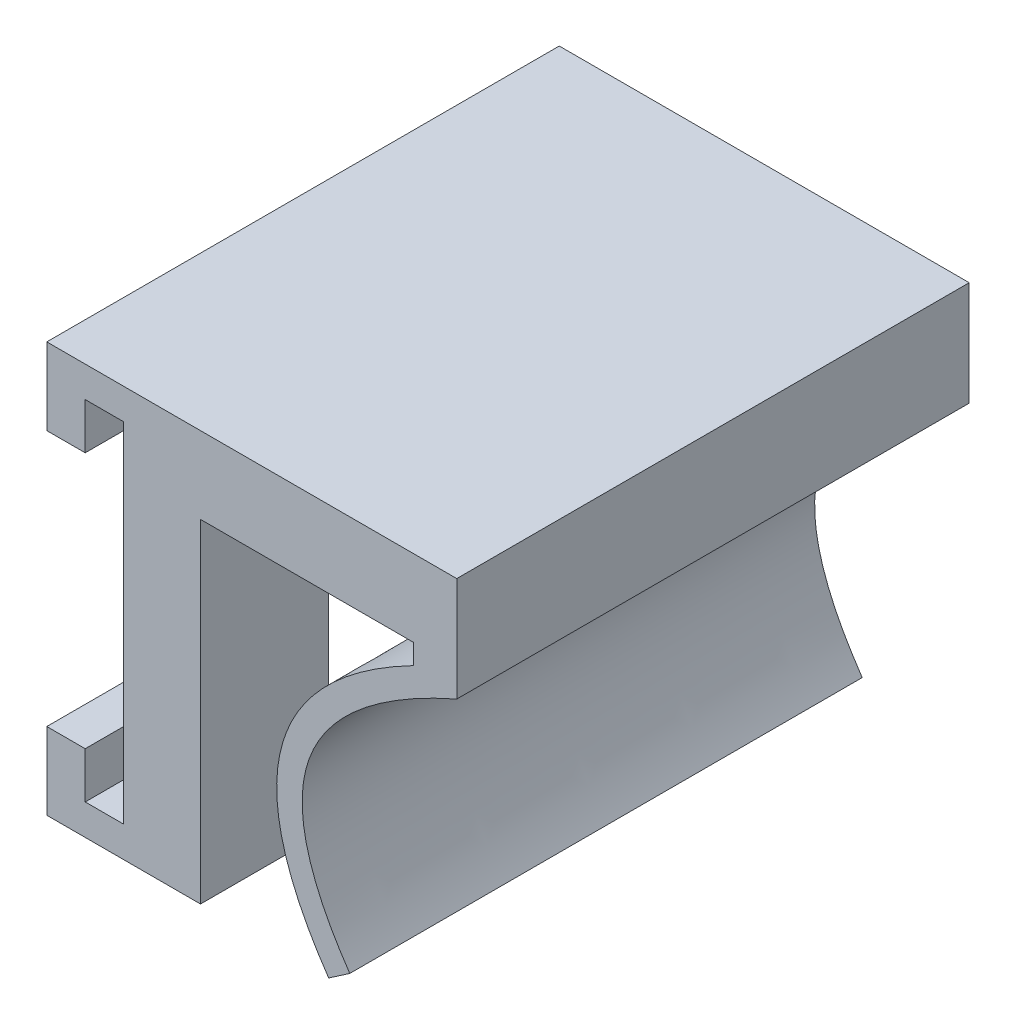
from build123d import *

# Parameters (mm, degrees)
AUFSATZ_LINEAR_AUSTRAGEN1_DEPTH = 20
SKIZZE2_W                       = 20
SKIZZE2_H                       = 3
AUFSATZ_LINEAR_AUSTRAGEN2_DEPTH = 3
SKIZZE3_W                       = 1.5
SKIZZE3_H                       = 20
SCHNITT_LINEAR_AUSTRAGEN1_DEPTH = 1.8
SKIZZE4_W                       = 1.5
SKIZZE4_H                       = 20
SCHNITT_LINEAR_AUSTRAGEN2_DEPTH = 1.8
SKIZZE14_W                      = 10
SKIZZE14_H                      = 13.6
SCHNITT_LINEAR_AUSTRAGEN5_DEPTH = 4
SKIZZE15_W                      = 10
SKIZZE15_H                      = 3
SCHNITT_LINEAR_AUSTRAGEN6_DEPTH = 6


# Read off the part's stored shape, not the designer's step: Aufsatz-Linear austragen1
with BuildPart() as part:
    # Aufsatz-Linear austragen1 outline → Aufsatz-Linear austragen1 (new body)
    with BuildSketch(Plane.XY):
        with BuildLine():
            Line((9.808332267, 5), (9.808332267, 4.212574368))
            add(Edge.make_bspline(
                [(9.808332267, 4.212574368), (1.184205361, -0.248328273), (6.5, -8)],
                knots=[0.083691521, 0.083691521, 0.083691521, 1, 1, 1], degree=2))
            Line((6.5, -8), (7.324710859, -7.434445405))
            add(Edge.make_bspline(
                [(11.5, 3.928207011), (11.209820184, 3.80014068), (10.506924616, 3.473790212), (9.167508184, 2.759616852), (7.676014914, 1.732695654), (6.437995439, 0.449518828), (5.702276721, -0.864348189), (5.405604765, -2.23902291), (5.529123845, -3.763138416), (6.029994776, -5.206555772), (6.676958994, -6.441666188), (7.105896283, -7.115968485), (7.324710859, -7.434445405)],
                knots=[0.019043297, 0.019043297, 0.019043297, 0.019043297, 0.0625, 0.125, 0.25, 0.375, 0.5, 0.625, 0.75, 0.875, 0.9375, 1, 1, 1, 1], degree=3))
            Line((11.5, 3.928207011), (11.5, 8))
            Line((11.5, 8), (-1.5, 8))
            Line((-1.5, 8), (-1.5, -8))
            Line((-1.5, -8), (1.5, -8))
            Line((1.5, -8), (1.5, 5))
            Line((1.5, 5), (9.808332267, 5))
        make_face()
    extrude(amount=AUFSATZ_LINEAR_AUSTRAGEN1_DEPTH)

    # Skizze2 → Aufsatz-Linear austragen2 (add)
    with BuildSketch(Plane.ZY.offset(1.5)):
        with Locations((10, 6.5)):
            Rectangle(SKIZZE2_W, SKIZZE2_H)
        with Locations((10, -6.5)):
            Rectangle(SKIZZE2_W, SKIZZE2_H)
    extrude(amount=AUFSATZ_LINEAR_AUSTRAGEN2_DEPTH)

    # Skizze3 → Schnitt-Linear austragen1 (cut)
    with BuildSketch(Plane.XZ.offset(-5)):
        with Locations((-2.25, 10)):
            Rectangle(SKIZZE3_W, SKIZZE3_H)
    extrude(amount=-SCHNITT_LINEAR_AUSTRAGEN1_DEPTH, mode=Mode.SUBTRACT)

    # Skizze4 → Schnitt-Linear austragen2 (cut)
    with BuildSketch(Plane(origin=(0, -5, 0), x_dir=(1, 0, 0), z_dir=(0, 1, 0))):
        with Locations((-2.25, -10)):
            Rectangle(SKIZZE4_W, SKIZZE4_H)
    extrude(amount=-SCHNITT_LINEAR_AUSTRAGEN2_DEPTH, mode=Mode.SUBTRACT)

    # Skizze14 → Schnitt-Linear austragen5 (cut)
    with BuildSketch(Plane.ZY.offset(1.5)):
        with Locations((10, 0)):
            Rectangle(SKIZZE14_W, SKIZZE14_H)
    extrude(amount=-SCHNITT_LINEAR_AUSTRAGEN5_DEPTH, mode=Mode.SUBTRACT)

    # Skizze15 → Schnitt-Linear austragen6 (cut)
    with BuildSketch(Plane.ZY.offset(4.5)):
        with Locations((10, -6.5)):
            Rectangle(SKIZZE15_W, SKIZZE15_H)
    extrude(amount=-SCHNITT_LINEAR_AUSTRAGEN6_DEPTH, mode=Mode.SUBTRACT)


solid = part.part
